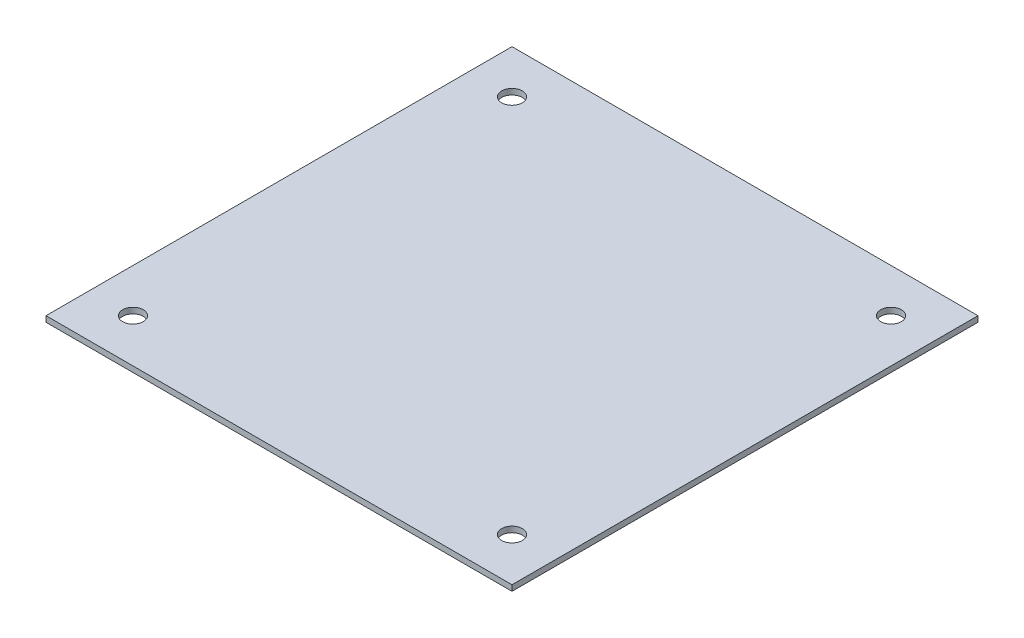
from build123d import *

# Parameters (mm, degrees)
SKETCH1_W          = 406.4
SKETCH1_H          = 5
BASE_FLANGE1_DEPTH = 406.4
CUT_EXTRUDE1_DEPTH = 575.758140438


# Sheet-metal steps are written as plain solids
with BuildPart() as part:
    # Sketch1 → Base-Flange1 (new body)
    with BuildSketch(Plane.XY):
        with Locations((203.2, -2.5)):
            Rectangle(SKETCH1_W, SKETCH1_H)
    extrude(amount=BASE_FLANGE1_DEPTH)

    # Sketch6 → Cut-Extrude1 (cut, through all)
    with BuildSketch(Plane(origin=(0, 0, 0), x_dir=(1, 0, 0), z_dir=(0, 1, 0))):
        with BuildLine():
            ThreePointArc((46.915065607, -37.915065607), (41.359216499, -29.600149815), (31.551104577, -31.551104577))
            Line((31.551104577, -31.551104577), (37.915065607, -37.915065607))
            Line((37.915065607, -37.915065607), (44.279026638, -44.279026638))
            ThreePointArc((44.279026638, -44.279026638), (46.2299814, -41.359216499), (46.915065607, -37.915065607))
        make_face()
        with BuildLine():
            Line((37.915065607, -37.915065607), (31.551104577, -31.551104577))
            ThreePointArc((31.551104577, -31.551104577), (31.551104577, -44.279026638), (44.279026638, -44.279026638))
            Line((44.279026638, -44.279026638), (37.915065607, -37.915065607))
        make_face()
        with BuildLine():
            ThreePointArc((377.484934393, -37.915065607), (376.799850185, -34.470914716), (374.848895423, -31.551104577))
            Line((374.848895423, -31.551104577), (368.484934393, -37.915065607))
            Line((368.484934393, -37.915065607), (362.120973362, -44.279026638))
            ThreePointArc((362.120973362, -44.279026638), (371.929085284, -46.2299814), (377.484934393, -37.915065607))
        make_face()
        with BuildLine():
            Line((368.484934393, -37.915065607), (374.848895423, -31.551104577))
            ThreePointArc((374.848895423, -31.551104577), (362.120973362, -31.551104577), (362.120973362, -44.279026638))
            Line((362.120973362, -44.279026638), (368.484934393, -37.915065607))
        make_face()
        with BuildLine():
            ThreePointArc((362.120973362, -362.120973362), (362.120973362, -374.848895423), (374.848895423, -374.848895423))
            Line((374.848895423, -374.848895423), (368.484934393, -368.484934393))
            Line((368.484934393, -368.484934393), (362.120973362, -362.120973362))
        make_face()
        with BuildLine():
            Line((368.484934393, -368.484934393), (374.848895423, -374.848895423))
            ThreePointArc((374.848895423, -374.848895423), (376.799850185, -371.929085284), (377.484934393, -368.484934393))
            ThreePointArc((377.484934393, -368.484934393), (371.929085284, -360.1700186), (362.120973362, -362.120973362))
            Line((362.120973362, -362.120973362), (368.484934393, -368.484934393))
        make_face()
        with BuildLine():
            ThreePointArc((44.279026638, -362.120973362), (31.551104577, -362.120973362), (31.551104577, -374.848895423))
            Line((31.551104577, -374.848895423), (37.915065607, -368.484934393))
            Line((37.915065607, -368.484934393), (44.279026638, -362.120973362))
        make_face()
        with BuildLine():
            Line((37.915065607, -368.484934393), (31.551104577, -374.848895423))
            ThreePointArc((31.551104577, -374.848895423), (41.359216499, -376.799850185), (46.915065607, -368.484934393))
            ThreePointArc((46.915065607, -368.484934393), (46.2299814, -365.040783501), (44.279026638, -362.120973362))
            Line((44.279026638, -362.120973362), (37.915065607, -368.484934393))
        make_face()
    extrude(amount=-CUT_EXTRUDE1_DEPTH, mode=Mode.SUBTRACT)


solid = part.part
